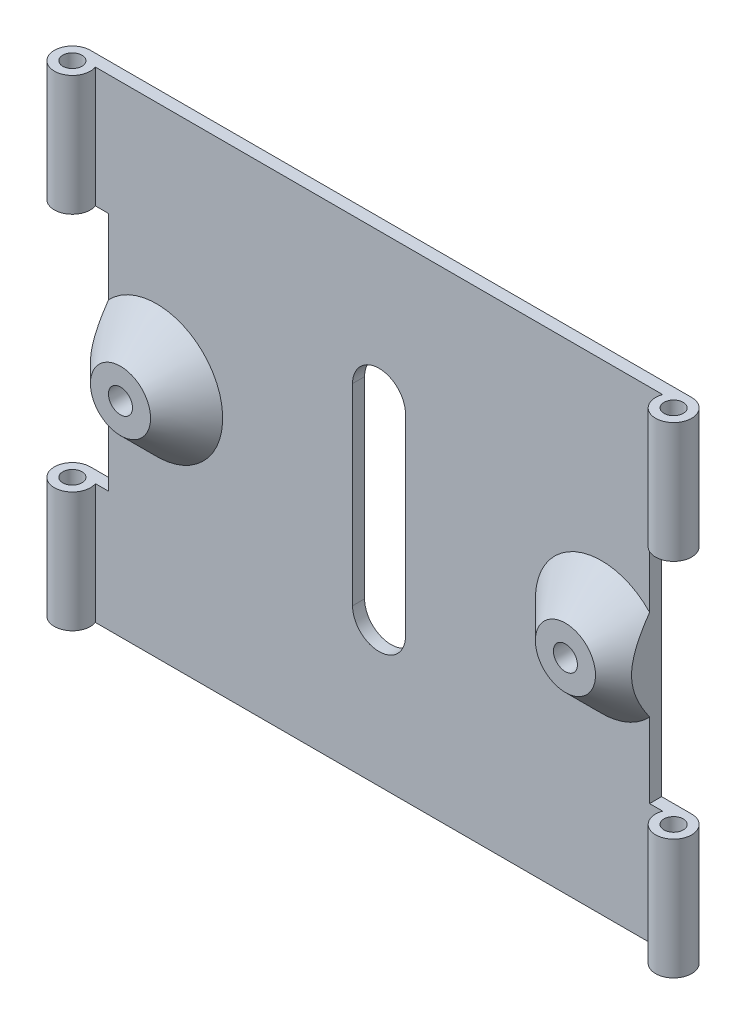
from build123d import *

# Parameters (mm, degrees)
SKETCH1_W               = 50
SKETCH1_H               = 40
BOSS_EXTRUDE1_DEPTH     = 1
SKETCH2_R               = 1.5
BOSS_EXTRUDE2_DEPTH     = 40
SKETCH3_R               = 0.8
CUT_EXTRUDE1_DEPTH      = 49.075461516
CUT_EXTRUDE2_DEPTH      = 34.260336739
CUT_EXTRUDE2_DEPTH_BACK = 34.260336739
SKETCH4_W               = 29.985936658
SKETCH4_H               = 20
SKETCH4_W_2             = 10.666279811
SKETCH5_R               = 2.5
SKETCH5_R_2             = 1
BOSS_EXTRUDE3_DEPTH     = 3
CHAMFER1_SIZE           = 3


with BuildPart() as part:
    # Sketch1 → Boss-Extrude1 (new body)
    with BuildSketch(Plane.XY):
        Rectangle(SKETCH1_W, SKETCH1_H)
        with BuildLine():
            Line((2.2, 7.898513293), (2.2, -8.101486707))
            ThreePointArc((2.2, -8.101486707), (0, -10.301486707), (-2.2, -8.101486707))
            Line((-2.2, -8.101486707), (-2.2, 7.898513293))
            ThreePointArc((-2.2, 7.898513293), (0, 10.098513293), (2.2, 7.898513293))
        make_face(mode=Mode.SUBTRACT)
    extrude(amount=BOSS_EXTRUDE1_DEPTH)

    # Sketch2 → Boss-Extrude2 (add)
    with BuildSketch(Plane(origin=(0, 20, 0), x_dir=(1, 0, 0), z_dir=(0, 1, 0))):
        with Locations((-25, -1.5)):
            Circle(SKETCH2_R)
        with Locations((25, -1.5)):
            Circle(SKETCH2_R)
    extrude(amount=-BOSS_EXTRUDE2_DEPTH)

    # Sketch3 → Cut-Extrude1 (cut, through all)
    with BuildSketch(Plane(origin=(0, 20, 0), x_dir=(1, 0, 0), z_dir=(0, 1, 0))):
        with Locations(Location((-25, -1.5, 0), (0, 0, 270))):
            Circle(SKETCH3_R)
        with Locations(Location((25, -1.5, 0), (0, 0, 270))):
            Circle(SKETCH3_R)
    extrude(amount=-CUT_EXTRUDE1_DEPTH, mode=Mode.SUBTRACT)

    # Sketch4 → Cut-Extrude2 (cut, two sides: drawn at the far end of the back side and taken through both)
    with BuildSketch(Plane.XY.offset(1).offset(-CUT_EXTRUDE2_DEPTH_BACK)):
        with Locations((-37.492968329, 0)):
            Rectangle(SKETCH4_W, SKETCH4_H)
        with Locations((27.833139906, 0)):
            Rectangle(SKETCH4_W_2, SKETCH4_H)
    extrude(amount=CUT_EXTRUDE2_DEPTH + CUT_EXTRUDE2_DEPTH_BACK, mode=Mode.SUBTRACT)

    # Sketch5 → Boss-Extrude3 (add)
    # profile 1 of 2: a face of its own
    with BuildSketch(Plane.XY.offset(1)):
        with Locations(Location((-18.5, 0, 0), (0, 0, 180))):
            Circle(SKETCH5_R)
        with Locations((-18.5, 0)):
            Circle(SKETCH5_R_2, mode=Mode.SUBTRACT)
    # profile 2 of 2: a face of its own
    with BuildSketch(Plane.XY.offset(1)):
        with Locations(Location((18.5, 0, 0), (0, 0, 180))):
            Circle(SKETCH5_R)
        with Locations((18.5, 0)):
            Circle(SKETCH5_R_2, mode=Mode.SUBTRACT)
    extrude(amount=BOSS_EXTRUDE3_DEPTH)

    # Chamfer1
    # the kernel refuses this chamfer: 3 mm, written as the material it adds along each edge
    with BuildSketch(Plane(origin=(-18.5, 0, 1), x_dir=(-1, 0, 0), z_dir=(0, 1, 0))) as chamfer1_piece_1_section:
        Polygon((2.5 + CHAMFER1_SIZE, 0), (2.5, CHAMFER1_SIZE), (2.5, 0), align=None)
    chamfer1_piece_1 = revolve(axis=Axis((-18.5, 0, 1), (0, 0, 1)), mode=Mode.PRIVATE)
    chamfer1_piece_1 = split(chamfer1_piece_1, bisect_by=Plane(origin=(-22.5, 0, 2.424420983), z_dir=(1, 0, 0)), keep=Keep.TOP, mode=Mode.PRIVATE)
    chamfer1_piece_1 = split(chamfer1_piece_1, bisect_by=Plane(origin=(-14.490726203, 0, 4), z_dir=(0, 0, -1)), keep=Keep.TOP, mode=Mode.PRIVATE)
    add(chamfer1_piece_1)
    with BuildSketch(Plane(origin=(18.5, 0, 1), x_dir=(-1, 0, 0), z_dir=(0, 1, 0))) as chamfer1_piece_2_section:
        Polygon((2.5 + CHAMFER1_SIZE, 0), (2.5, CHAMFER1_SIZE), (2.5, 0), align=None)
    chamfer1_piece_2 = revolve(axis=Axis((18.5, 0, 1), (0, 0, 1)), mode=Mode.PRIVATE)
    chamfer1_piece_2 = split(chamfer1_piece_2, bisect_by=Plane(origin=(22.5, -4.362653262, 1.396136714), z_dir=(-1, 0, 0)), keep=Keep.TOP, mode=Mode.PRIVATE)
    chamfer1_piece_2 = split(chamfer1_piece_2, bisect_by=Plane(origin=(15.981220965, -4.362653262, 4), z_dir=(0, 0, -1)), keep=Keep.TOP, mode=Mode.PRIVATE)
    add(chamfer1_piece_2)


solid = part.part
